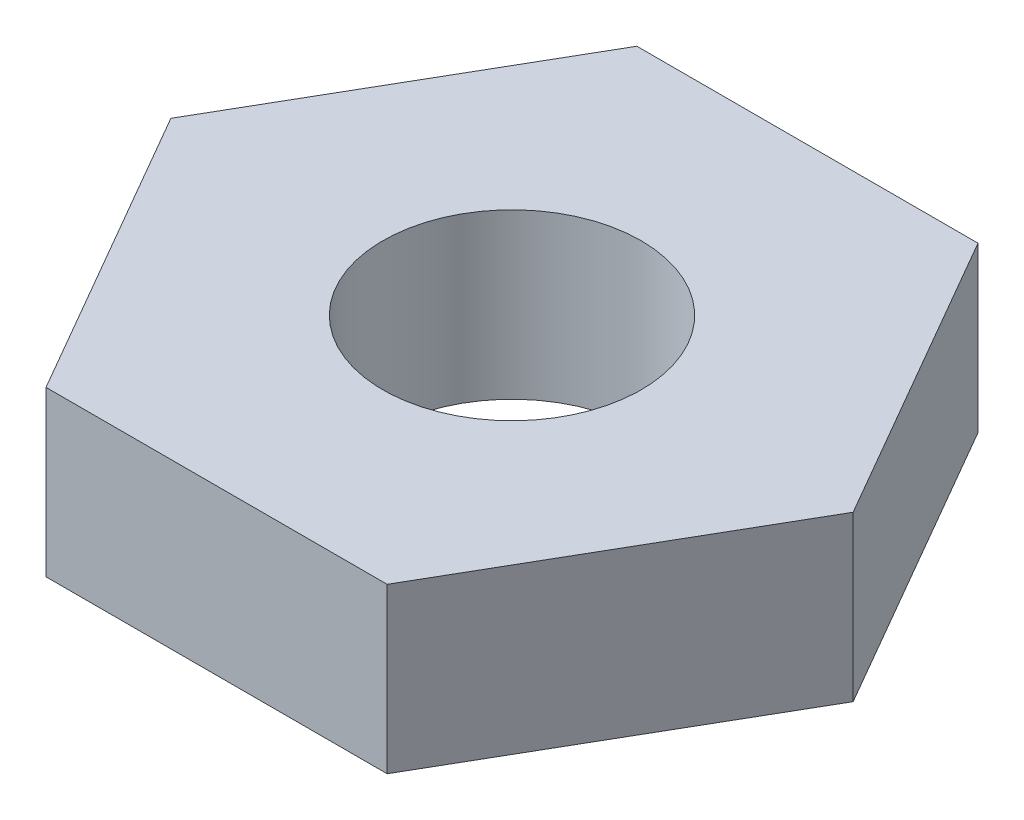
from build123d import *

# Parameters (mm, degrees)
SKETCH1_R           = 1.5
BOSS_EXTRUDE1_DEPTH = 1.905


with BuildPart() as part:
    # Sketch1 → Boss-Extrude1 (new body)
    with BuildSketch(Plane(origin=(0, 0, 0), x_dir=(1, 0, 0), z_dir=(0, 1, 0))):
        Polygon((1.980311423, -3.43), (3.960622847, 0), (1.980311423, 3.43), (-1.980311423, 3.43), (-3.960622847, 0), (-1.980311423, -3.43), align=None)
        Circle(SKETCH1_R, mode=Mode.SUBTRACT)
    extrude(amount=BOSS_EXTRUDE1_DEPTH)


solid = part.part
